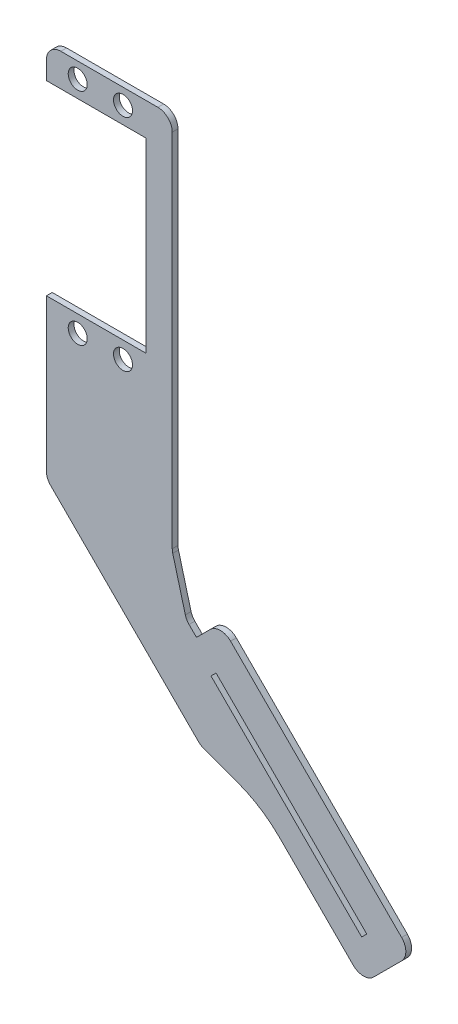
from build123d import *

# Parameters (mm, degrees)
SKETCH1_R                    = 2.099999991
BASE_FLANGE1_DEPTH           = 1.27
EDGE_FLANGE2_STRIP_W         = 6.5532
EDGE_FLANGE2_STRIP_H         = 1.27
EDGE_FLANGE2_STRIP_CUT_DEPTH = 59.775021713
EDGE_FLANGE2_DEPTH           = 59.775021713
SKETCH14_W                   = 1.779250061
SKETCH14_H                   = 41.153999988
CUT_EXTRUDE1_DEPTH           = 148.532360138
CUT_EXTRUDE_THIN2_START      = 2.868175785
CUT_EXTRUDE_THIN2_DEPTH      = 59.775021713
CUT_EXTRUDE_THIN2_START_2    = 9.218175785
CUT_EXTRUDE_THIN2_2_DEPTH    = 47.075021713
CUT_EXTRUDE_THIN2_3_DEPTH    = 59.775021713
CUT_EXTRUDE_THIN2_4_DEPTH    = 6.35
CUT_EXTRUDE_THIN2_START_3    = 56.293197498
CUT_EXTRUDE_THIN2_5_DEPTH    = 6.35
BOSS_EXTRUDE1_DEPTH          = 1.27
FILLET1_R                    = 25.4
FILLET2_R                    = 3.175


# Read off the part's stored shape, not the designer's step: Cut-Extrude-Thin2
# Sheet-metal steps are written as plain solids
with BuildPart() as part:
    # Sketch1 → Base-Flange1 (new body)
    with BuildSketch(Plane.XY):
        Polygon((-24.438645943, -113.029505435), (-19.05049227, -107.641351762), (-63.562879499, -63.128964533), (-66.675, -51.514372705), (-66.675, 31.75), (-94.45625, 31.75), (-94.45625, -51.514372705), (-80.565625, -65.404997705), (-68.951033172, -68.517118206), align=None)
        with Locations((-87.550000033, 28.272999969)):
            Circle(SKETCH1_R, mode=Mode.SUBTRACT)
        with Locations((-77.549999967, 28.272999969)):
            Circle(SKETCH1_R, mode=Mode.SUBTRACT)
        with Locations((-87.550000033, -20.327000113)):
            Circle(SKETCH1_R, mode=Mode.SUBTRACT)
        with Locations((-77.549999967, -20.327000113)):
            Circle(SKETCH1_R, mode=Mode.SUBTRACT)
        Polygon((-92.676999939, -16.604000066), (-83.05, -16.604000066), (-82.05, -16.604000066), (-72.423000061, -16.604000066), (-72.423000061, 24.549999922), (-82.05, 24.549999922), (-83.05, 24.549999922), (-92.676999939, 24.549999922), align=None, mode=Mode.SUBTRACT)
    extrude(amount=BASE_FLANGE1_DEPTH)

    # Edge-Flange2 strip (across the edge) → Edge-Flange2 strip cut (cut)
    with BuildSketch(Plane(origin=(-19.05049227, -107.641351762, 1.27), x_dir=(-0.707106781186551, -0.707106781186544, 3.4914813388431334e-15), z_dir=(-0.707106781186544, 0.707106781186551, 0))):
        with Locations((-1.27, -0.635)):
            Rectangle(EDGE_FLANGE2_STRIP_W, EDGE_FLANGE2_STRIP_H)
    extrude(amount=EDGE_FLANGE2_STRIP_CUT_DEPTH, mode=Mode.SUBTRACT)

    # Edge-Flange2 section (across the edge) → Edge-Flange2 (add)
    with BuildSketch(Plane(origin=(-19.05049227, -107.641351762, 1.27), x_dir=(-0.707106781186551, -0.707106781186544, 3.4914813388431334e-15), z_dir=(-0.707106781186544, 0.707106781186551, 0))):
        with BuildLine():
            Line((0, 0.7366), (0, 8.255))
            Line((0, 8.255), (1.27, 8.255))
            Line((1.27, 8.255), (1.27, 0.7366))
            ThreePointArc((1.27, 0.7366), (1.485745145, 0.215745145), (2.0066, 0))
            Line((2.0066, 0), (2.0066, -1.27))
            ThreePointArc((2.0066, -1.27), (0.587719533, -0.682280467), (0, 0.7366))
        make_face()
    extrude(amount=EDGE_FLANGE2_DEPTH)

    # Sketch14 → Cut-Extrude1 (cut, through all)
    with BuildSketch(Plane.XY.offset(1.27)):
        with Locations((-93.56662497, 3.972999928)):
            Rectangle(SKETCH14_W, SKETCH14_H)
    extrude(amount=-CUT_EXTRUDE1_DEPTH, mode=Mode.SUBTRACT)

    # Cut-Extrude-Thin2 outline → Cut-Extrude-Thin2 (cut)
    with BuildSketch(Plane(origin=(0, 0, 0), x_dir=(0.7071067811865438, 0.7071067811865512, 0), z_dir=(0.7071067811865511, -0.7071067811865441, 0)).offset(CUT_EXTRUDE_THIN2_START)):
        with BuildLine():
            Line((-91.591262036, 1.27), (-89.724750852, 1.27))
            ThreePointArc((-89.724750852, 1.27), (-89.619995324, 1.631698534), (-89.584662036, 2.0066))
            Line((-89.584662036, 2.0066), (-89.584662036, 9.525))
            Line((-89.584662036, 9.525), (-90.854662036, 9.525))
            Line((-90.854662036, 9.525), (-90.854662036, 2.0066))
            ThreePointArc((-90.854662036, 2.0066), (-91.070407181, 1.485745145), (-91.591262036, 1.27))
        make_face()
    extrude(amount=CUT_EXTRUDE_THIN2_DEPTH, mode=Mode.SUBTRACT)

    # Cut-Extrude-Thin2 2 outline → Cut-Extrude-Thin2 2 (cut)
    with BuildSketch(Plane(origin=(0, 0, 0), x_dir=(0.7071067811865438, 0.7071067811865512, 0), z_dir=(0.7071067811865511, -0.7071067811865441, 0)).offset(CUT_EXTRUDE_THIN2_START_2)):
        with BuildLine():
            ThreePointArc((-91.407505482, 0.008431566), (-90.480448103, 0.335511742), (-89.820005482, 1.063682305))
            Line((-89.820005482, 1.063682305), (-89.820005482, 1.27))
            Line((-89.820005482, 1.27), (-91.407505482, 1.27))
            Line((-91.407505482, 1.27), (-91.407505482, 0.008431566))
        make_face()
    extrude(amount=CUT_EXTRUDE_THIN2_2_DEPTH, mode=Mode.SUBTRACT)

    # Cut-Extrude-Thin2 3 outline → Cut-Extrude-Thin2 3 (add)
    with BuildSketch(Plane(origin=(0, 0, 0), x_dir=(0.7071067811865438, 0.7071067811865512, 0), z_dir=(0.7071067811865511, -0.7071067811865441, 0)).offset(CUT_EXTRUDE_THIN2_START)):
        with BuildLine():
            Line((-89.820005482, 0), (-82.117848928, 0))
            Line((-82.117848928, 0), (-82.117848928, 1.27))
            Line((-82.117848928, 1.27), (-89.724750852, 1.27))
            ThreePointArc((-89.724750852, 1.27), (-89.769455165, 1.165491634), (-89.820005482, 1.063682305))
            Line((-89.820005482, 1.063682305), (-89.820005482, 0))
        make_face()
        with BuildLine():
            Line((-91.591262036, 0), (-91.407505482, 0))
            Line((-91.407505482, 0), (-91.407505482, 0.008431566))
            ThreePointArc((-91.407505482, 0.008431566), (-91.49928709, 0.002109), (-91.591262036, 0))
        make_face()
    extrude(amount=CUT_EXTRUDE_THIN2_3_DEPTH)

    # Cut-Extrude-Thin2 4 outline → Cut-Extrude-Thin2 4 (add)
    with BuildSketch(Plane(origin=(0, 0, 0), x_dir=(0.7071067811865438, 0.7071067811865512, 0), z_dir=(0.7071067811865511, -0.7071067811865441, 0)).offset(CUT_EXTRUDE_THIN2_START)):
        with BuildLine():
            Line((-91.407505482, 0), (-89.820005482, 0))
            Line((-89.820005482, 0), (-89.820005482, 1.063682305))
            ThreePointArc((-89.820005482, 1.063682305), (-90.480448103, 0.335511742), (-91.407505482, 0.008431566))
            Line((-91.407505482, 0.008431566), (-91.407505482, 0))
        make_face()
    extrude(amount=CUT_EXTRUDE_THIN2_4_DEPTH)

    # Cut-Extrude-Thin2 5 outline → Cut-Extrude-Thin2 5 (add)
    with BuildSketch(Plane(origin=(0, 0, 0), x_dir=(0.7071067811865438, 0.7071067811865512, 0), z_dir=(0.7071067811865511, -0.7071067811865441, 0)).offset(CUT_EXTRUDE_THIN2_START_3)):
        with BuildLine():
            Line((-91.407505482, 0), (-89.820005482, 0))
            Line((-89.820005482, 0), (-89.820005482, 1.063682305))
            ThreePointArc((-89.820005482, 1.063682305), (-90.480448103, 0.335511742), (-91.407505482, 0.008431566))
            Line((-91.407505482, 0.008431566), (-91.407505482, 0))
        make_face()
    extrude(amount=CUT_EXTRUDE_THIN2_5_DEPTH)

    # Sketch17 → Boss-Extrude1 (add)
    with BuildSketch(Plane.XY.offset(1.27)):
        Polygon((-68.951033172, -68.517118206), (-80.565625, -65.404997705), (-60.360048728, -85.610573978), (-46.992008762, -90.476142615), align=None)
    extrude(amount=-BOSS_EXTRUDE1_DEPTH)

    # Fillet1
    fillet1_edges = [part.edges().sort_by_distance(p)[0] for p in [
        (-46.992008762, -90.476142615, 0.635),
    ]]
    fillet(fillet1_edges, radius=FILLET1_R)

    # Fillet2
    fillet2_edges = [part.edges().sort_by_distance(p)[0] for p in [
        (-94.45625, 31.75, 0.635),
        (-66.675, 31.75, 0.635),
        (-66.675, -51.514372705, 0.635),
        (-63.562879499, -63.128964533, 0.635),
        (-94.45625, -51.514372705, 0.635),
        (-24.438645943, -113.029505435, 0.635),
        (-60.360048728, -85.610573978, 0.635),
        (-13.770658087, -102.361517579, 0.635),
        (-56.037981286, -60.094194381, 0.635),
    ]]
    fillet(fillet2_edges, radius=FILLET2_R)


solid = part.part
